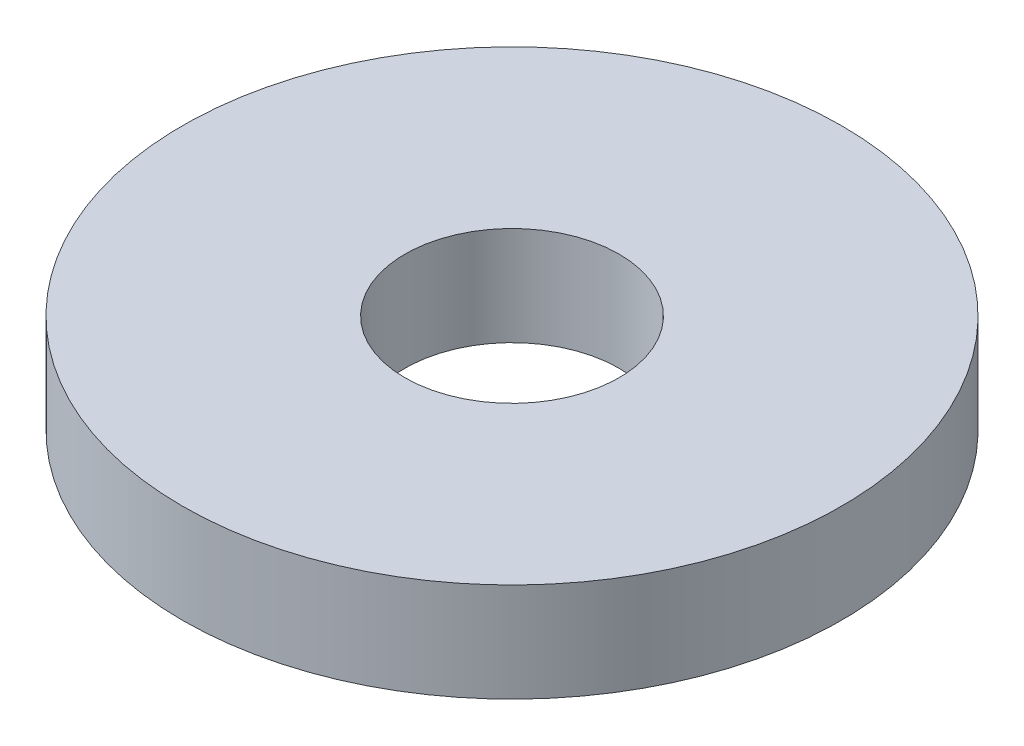
from build123d import *

# Parameters (mm, degrees)
ESQUISSE1_R        = 10
ESQUISSE1_R_2      = 3.25
BOSS_EXTRU_1_DEPTH = 3


with BuildPart() as part:
    # Esquisse1 → Boss.-Extru.1 (new body)
    with BuildSketch(Plane(origin=(0, 0, 0), x_dir=(1, 0, 0), z_dir=(0, 1, 0))):
        Circle(ESQUISSE1_R)
        Circle(ESQUISSE1_R_2, mode=Mode.SUBTRACT)
    extrude(amount=BOSS_EXTRU_1_DEPTH)


solid = part.part
